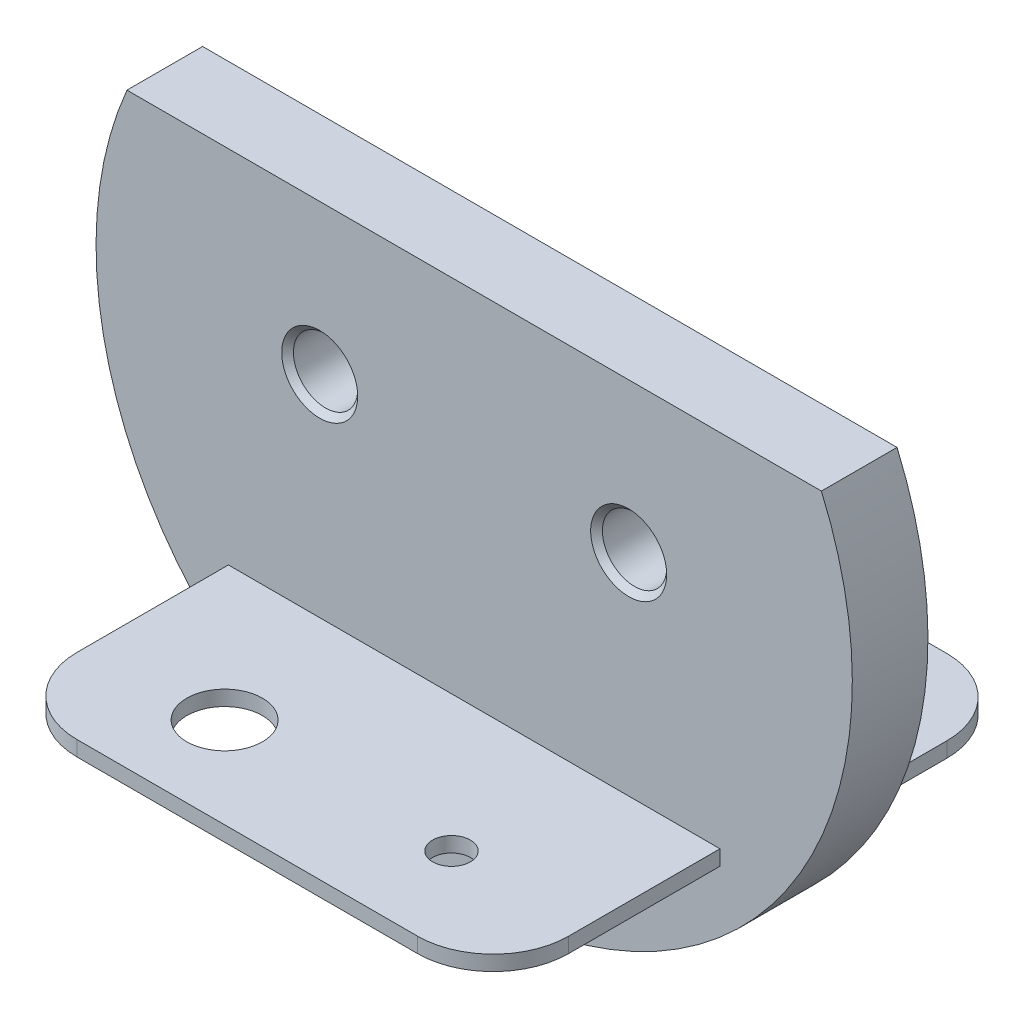
from build123d import *

# Parameters (mm, degrees)
SKETCH_1_R                    = 50
EXTRUDE_1_DEPTH               = 10
HOLE_WIZARD_M10_1_D           = 8.5
HOLE_WIZARD_M10_1_CSINK_D     = 10.05
HOLE_WIZARD_M10_1_CSINK_ANGLE = 90
SKETCH_16_W                   = 65
SKETCH_16_H                   = 2
EXTRUDE_2_DEPTH               = 30
FILLET_2_R                    = 10
CUT_EXTRUDE_1_REACH           = 104.364
SKETCH_20_R                   = 5
SKETCH_20_R_2                 = 2.5
SKETCH_27_W                   = 65
SKETCH_27_H                   = 2
EXTRUDE_3_DEPTH               = 30
FILLET_4_R                    = 10
SKETCH_29_R                   = 2.5
CUT_EXTRUDE_2_DEPTH           = 103.860342212
CUT_EXTRUDE_3_DEPTH           = 82.240384046


with BuildPart() as part:
    # 草图1 → 凸台-拉伸1 (new body)
    with BuildSketch(Plane.XY):
        Circle(SKETCH_1_R)
    extrude(amount=EXTRUDE_1_DEPTH)

    # M10 螺纹孔1 (through all)
    with Locations(Plane.XY.offset(10)):
        with Locations((-20.426671729, 0)):
            hole_wizard_m10_1 = CounterSinkHole(HOLE_WIZARD_M10_1_D / 2, HOLE_WIZARD_M10_1_CSINK_D / 2, counter_sink_angle=HOLE_WIZARD_M10_1_CSINK_ANGLE)

    # 镜向2: M10 螺纹孔1 across plane
    add(hole_wizard_m10_1.mirror(Plane(origin=(0, 0, 0), x_dir=(0, 0, 1), z_dir=(1, 0, 0))), mode=Mode.SUBTRACT)

    # 草图16 → 凸台-拉伸2 (add)
    with BuildSketch(Plane.XY.offset(10)):
        with Locations((0, -28.864937428)):
            Rectangle(SKETCH_16_W, SKETCH_16_H)
    extrude(amount=EXTRUDE_2_DEPTH)

    # 圆角2
    fillet_2_edges = [part.edges().sort_by_distance(p)[0] for p in [
        (32.5, -28.864937428, 40),
        (-32.5, -28.864937428, 40),
    ]]
    fillet(fillet_2_edges, radius=FILLET_2_R)

    # 草图20 → 切除-拉伸1 (cut, up to next)
    with BuildSketch(Plane.XZ.offset(29.864937428), mode=Mode.PRIVATE) as cut_extrude_1_sk1:
        with Locations((-15, 28)):
            Circle(SKETCH_20_R)
    cut_extrude_1_tool1 = extrude(cut_extrude_1_sk1.sketch, amount=-CUT_EXTRUDE_1_REACH, mode=Mode.PRIVATE) & part.part
    # 草图20 → 切除-拉伸1 (cut, up to next)
    with BuildSketch(Plane.XZ.offset(29.864937428), mode=Mode.PRIVATE) as cut_extrude_1_sk2:
        with Locations((15, 28)):
            Circle(SKETCH_20_R_2)
    cut_extrude_1_tool2 = extrude(cut_extrude_1_sk2.sketch, amount=-CUT_EXTRUDE_1_REACH, mode=Mode.PRIVATE) & part.part
    add(cut_extrude_1_tool1.solids().sort_by_distance((-15, -29.864937, 28))[0], mode=Mode.SUBTRACT)
    add(cut_extrude_1_tool2.solids().sort_by_distance((15, -29.864937, 28))[0], mode=Mode.SUBTRACT)

    # 草图27 → 凸台-拉伸3 (add)
    with BuildSketch(Plane(origin=(0, 0, 0), x_dir=(-1, 0, 0), z_dir=(0, 0, -1))):
        with Locations((0, -31.5)):
            Rectangle(SKETCH_27_W, SKETCH_27_H)
    extrude(amount=EXTRUDE_3_DEPTH)

    # 圆角4
    fillet_4_edges = [part.edges().sort_by_distance(p)[0] for p in [
        (-32.5, -31.5, -30),
        (32.5, -31.5, -30),
    ]]
    fillet(fillet_4_edges, radius=FILLET_4_R)

    # 草图29 → 切除-拉伸2 (cut, through all)
    with BuildSketch(Plane(origin=(0, -30.5, 0), x_dir=(1, 0, 0), z_dir=(0, 1, 0))):
        with Locations((-15, 15.270734556)):
            Circle(SKETCH_29_R)
        with Locations((15, 15.270734556)):
            Circle(SKETCH_29_R)
    extrude(amount=-CUT_EXTRUDE_2_DEPTH, mode=Mode.SUBTRACT)

    # 草图30 → 切除-拉伸3 (cut, through all)
    with BuildSketch(Plane(origin=(0, 0, 0), x_dir=(-1, 0, 0), z_dir=(0, 0, -1))):
        with BuildLine():
            Line((-45.911665772, 19.801993486), (45.911665772, 19.801993486))
            ThreePointArc((45.911665772, 19.801993486), (0, 50), (-45.911665772, 19.801993486))
        make_face()
    extrude(amount=-CUT_EXTRUDE_3_DEPTH, mode=Mode.SUBTRACT)


solid = part.part
